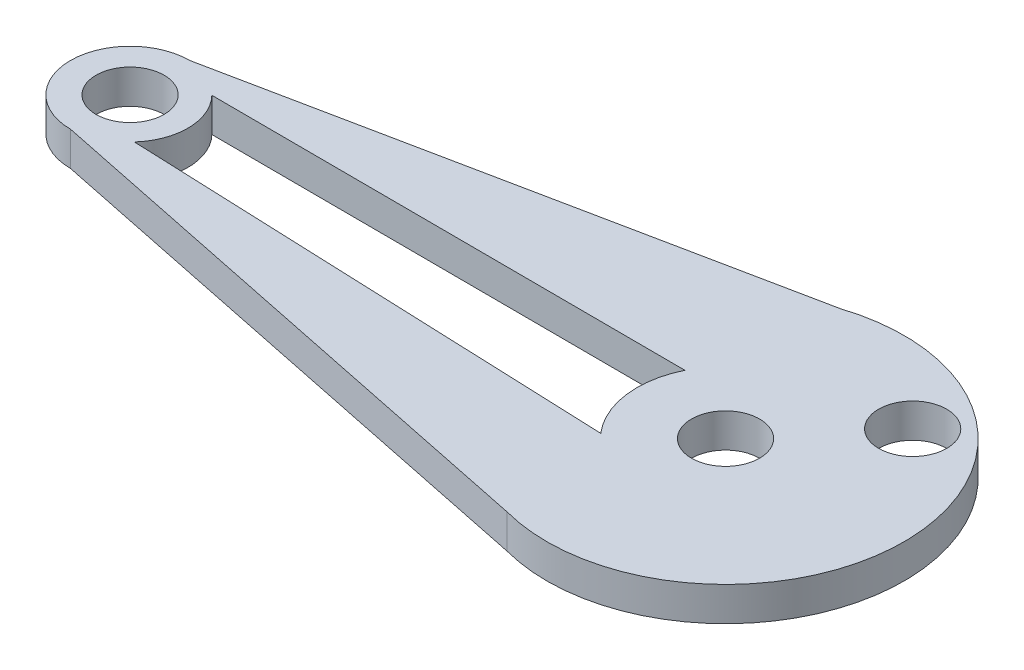
from build123d import *

# Parameters (mm, degrees)
SKETCH1_R           = 2
BOSS_EXTRUDE1_DEPTH = 2


with BuildPart() as part:
    # Sketch1 → Boss-Extrude1 (new body)
    with BuildSketch(Plane(origin=(0, 0, 0), x_dir=(1, 0, 0), z_dir=(0, 1, 0))):
        with BuildLine():
            Line((-51.630151438, -6.002739553), (-19.858687989, 0.48858427))
            ThreePointArc((-19.858687989, 0.48858427), (-6.134030431, -9.217355963), (-19.311002502, -19.654736282))
            Line((-19.311002502, -19.654736282), (-51.630151438, -13.002739553))
            ThreePointArc((-51.630151438, -13.002739553), (-55.130151438, -9.502739553), (-51.630151438, -6.002739553))
        make_face()
        with Locations((-16.630151438, -9.502739553)):
            Circle(SKETCH1_R, mode=Mode.SUBTRACT)
        with Locations((-51.630151438, -9.502739553)):
            Circle(SKETCH1_R, mode=Mode.SUBTRACT)
        with Locations((-11.630151438, -3.502739553)):
            Circle(SKETCH1_R, mode=Mode.SUBTRACT)
        with BuildLine():
            Line((-49.20201043, -7.122796016), (-21.30201043, -7.219379406))
            ThreePointArc((-21.30201043, -7.219379406), (-21.78692763, -10.171813025), (-20.564614553, -12.902739553))
            Line((-20.564614553, -12.902739553), (-49.10201043, -11.776173749))
            ThreePointArc((-49.10201043, -11.776173749), (-48.230936244, -9.429691213), (-49.20201043, -7.122796016))
        make_face(mode=Mode.SUBTRACT)
    extrude(amount=BOSS_EXTRUDE1_DEPTH)


solid = part.part
